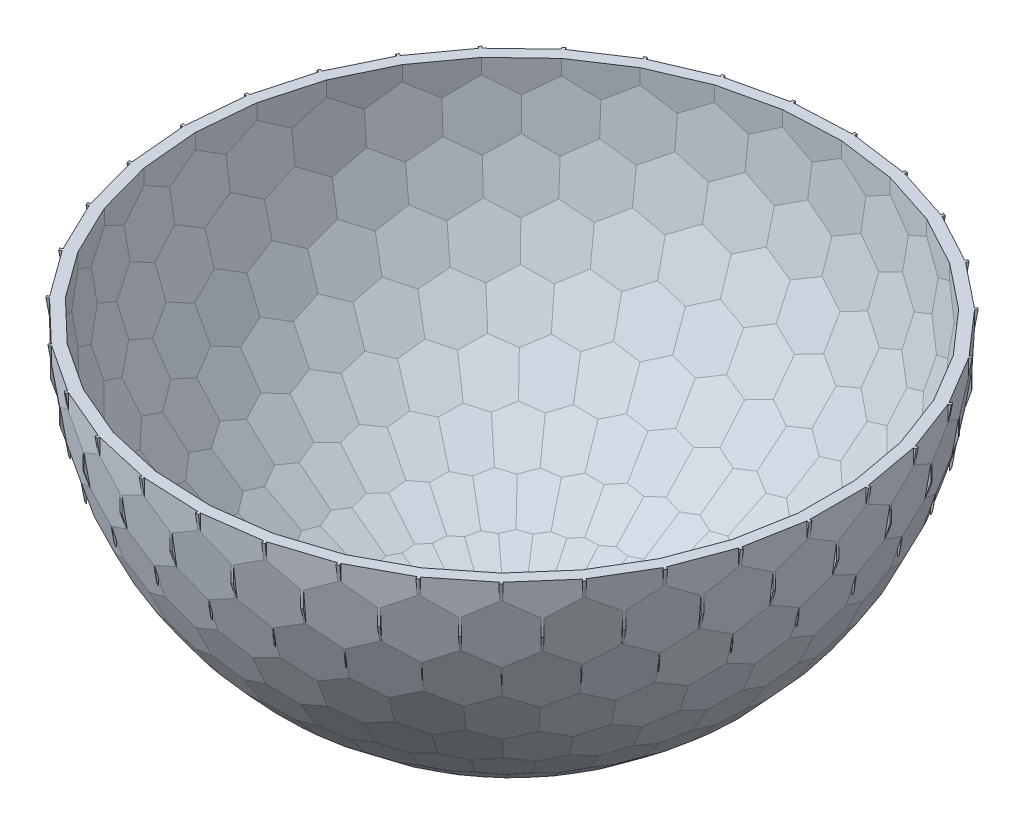
from build123d import *

# Parameters (mm, degrees)
SKETCH_2_OUTSIDE_W       = 157.96
SKETCH_2_OUTSIDE_H       = 97.357
CUT_EXTRUDE_2_DEPTH      = 5
PATTERN_CIRCULAR_2_COUNT = 35
SHELL_1_T                = -2


with BuildPart() as part:
    # 草图1 → 旋转1 (revolve)
    with BuildSketch(Plane.XY):
        with BuildLine():
            Line((0, 0), (60, 0))
            ThreePointArc((60, 0), (45.326846371, -39.312555222), (8.484100064, -59.397138366))
            Line((8.484100064, -59.397138366), (0, -59.397138366))
            Line((0, -59.397138366), (0, 0))
        make_face()
    revolve(axis=Axis((0, 0, 0), (0, -1, 0)))

    # 草图2 outside → 切除-拉伸2 (cut, symmetric)
    with BuildSketch(Plane.XY):
        with Locations((0, -29.6985)):
            Rectangle(SKETCH_2_OUTSIDE_W, SKETCH_2_OUTSIDE_H)
        Polygon((58, -8.742093399), (58, 8.742093399), (52.846445471, 25.449506833), (42.997252349, 39.895619902), (29.327564666, 50.796832064), (13.05199416, 57.184522779), (-4.383303304, 58.491117694), (-21.429125035, 54.600520119), (-36.570874965, 45.85842672), (-48.463142167, 33.041610861), (-56.04924651, 17.288902876), (-58.655129332, 0), (-56.04924651, -17.288902876), (-48.463142167, -33.041610861), (-36.570874965, -45.85842672), (-21.429125035, -54.600520119), (-4.383303304, -58.491117694), (13.05199416, -57.184522779), (29.327564666, -50.796832064), (42.997252349, -39.895619902), (52.846445471, -25.449506833), align=None, mode=Mode.SUBTRACT)
    cut_extrude_2 = extrude(amount=CUT_EXTRUDE_2_DEPTH, both=True, mode=Mode.SUBTRACT)

    # 阵列(圆周)2: 切除-拉伸2 ×35 about axis
    pattern_circular_2_axis = Axis((0, 0, 0), (0, 1, 0))
    for i in range(1, PATTERN_CIRCULAR_2_COUNT):
        add(cut_extrude_2.rotate(pattern_circular_2_axis, i * 360 / PATTERN_CIRCULAR_2_COUNT), mode=Mode.SUBTRACT)

    # 抽壳1
    shell_1_openings = [part.faces().sort_by_distance(p)[0] for p in [
        (0, 0, 0),
    ]]
    offset(amount=SHELL_1_T, openings=shell_1_openings)


solid = part.part
